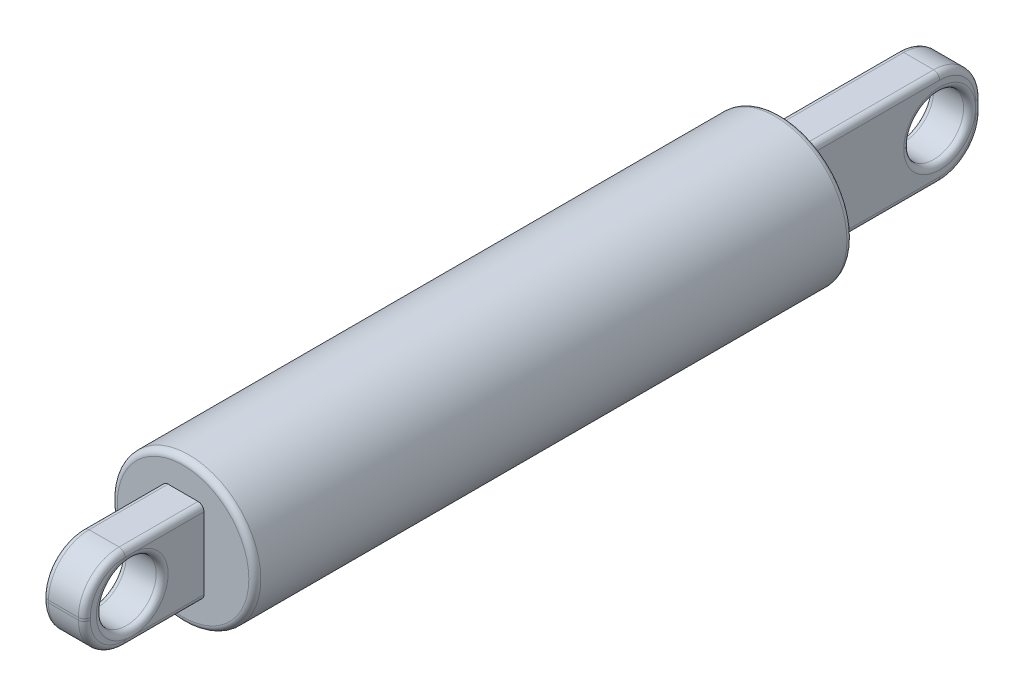
from build123d import *

# Parameters (mm, degrees)
SKETCH_1_R      = 6
EXTRUDE_1_DEPTH = 50
SKETCH_2_R      = 2.5
EXTRUDE_2_DEPTH = 1.75
FILLET_1_R      = 0.5
FILLET_3_R      = 0.5


with BuildPart() as part:
    # 草圖1 → 填料-伸長1 (new body)
    with BuildSketch(Plane.XY):
        Circle(SKETCH_1_R)
    extrude(amount=EXTRUDE_1_DEPTH)

    # 草圖2 → 填料-伸長2 (add, symmetric)
    # profile 1 of 2: a face of its own
    with BuildSketch(Plane(origin=(0, 0, 0), x_dir=(0, 0, -1), z_dir=(1, 0, 0))):
        with BuildLine():
            Line((11.5, 4), (0, 4))
            Line((0, 4), (0, -4))
            Line((0, -4), (11.5, -4))
            ThreePointArc((11.5, -4), (13.974873734, -2.974873734), (15, -0.5))
            Line((15, -0.5), (15, 0.5))
            ThreePointArc((15, 0.5), (13.974873734, 2.974873734), (11.5, 4))
        make_face()
        with Locations((11.5, 0)):
            Circle(SKETCH_2_R, mode=Mode.SUBTRACT)
    # profile 2 of 2: a face of its own
    with BuildSketch(Plane(origin=(0, 0, 0), x_dir=(0, 0, -1), z_dir=(1, 0, 0))):
        with BuildLine():
            Line((-50, -3.5), (-56.6, -3.5))
            ThreePointArc((-56.6, -3.5), (-59.004163056, -2.504163056), (-60, -0.1))
            Line((-60, -0.1), (-60, 0.1))
            ThreePointArc((-60, 0.1), (-59.004163056, 2.504163056), (-56.6, 3.5))
            Line((-56.6, 3.5), (-50, 3.5))
            Line((-50, 3.5), (-50, -3.5))
        make_face()
        with Locations((-56, 0)):
            Circle(SKETCH_2_R, mode=Mode.SUBTRACT)
    extrude(amount=EXTRUDE_2_DEPTH, both=True)

    # 圓角1
    fillet_1_edges = [part.edges().sort_by_distance(p)[0] for p in [
        (-1.75, -3.5, 53.3),
        (-1.75, -2.504163056, 59.004163056),
        (-1.75, 0, 60),
        (-1.75, 2.504163056, 59.004163056),
        (-1.75, 3.5, 53.3),
        (1.75, 4, -5.75),
        (1.75, 2.974873734, -13.974873734),
        (1.75, 0, -15),
        (1.75, -2.974873734, -13.974873734),
        (-1.75, -4, -5.75),
        (-1.75, -2.974873734, -13.974873734),
        (-1.75, 0, -15),
        (-1.75, 2.974873734, -13.974873734),
        (1.75, -3.5, 53.3),
        (1.75, -2.504163056, 59.004163056),
        (1.75, 0, 60),
        (1.75, 2.504163056, 59.004163056),
        (1.75, 0, -9),
        (1.75, -4, -5.75),
        (-1.75, 4, -5.75),
        (1.75, 0, 58.5),
        (1.75, 3.5, 53.3),
        (-1.75, 0, 58.5),
        (-1.75, 0, -9),
    ]]
    fillet(fillet_1_edges, radius=FILLET_1_R - 0.0001)  # a hair under: the kernel refuses the full size

    # 圓角3
    fillet_3_edges = [part.edges().sort_by_distance(p)[0] for p in [
        (-6, 0, 0),
        (-6, 0, 50),
    ]]
    fillet(fillet_3_edges, radius=FILLET_3_R)


solid = part.part
